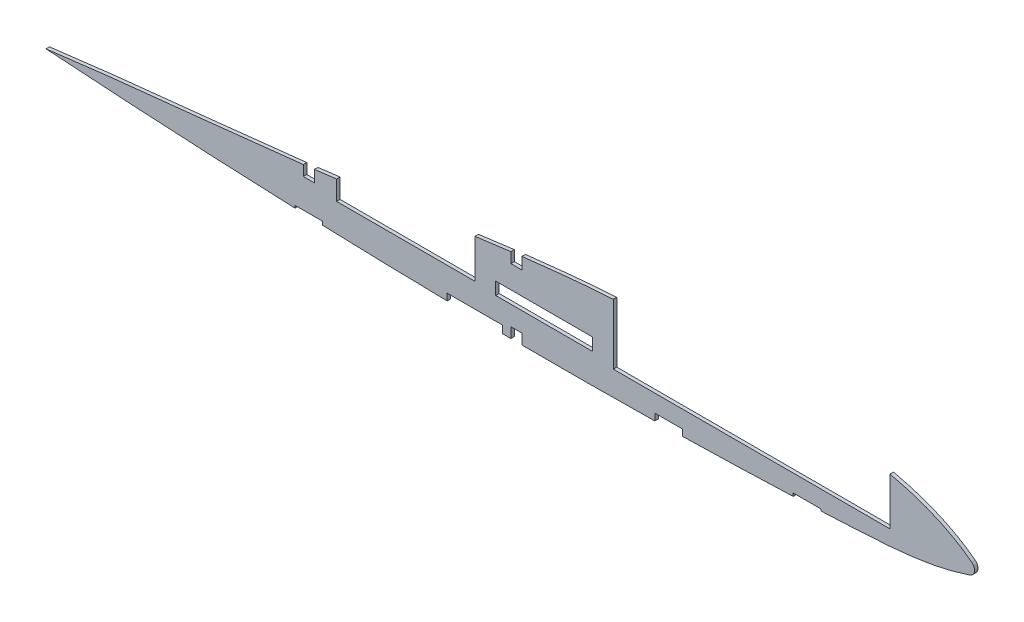
from build123d import *

# Parameters (mm, degrees)
BOSS_EXTRUDE1_DEPTH   = 3.175
FILLET1_R             = 6.35
CUT_EXTRUDE5_REACH    = 505.743
SKETCH5_W             = 88.9
SKETCH5_H             = 11.43
CUT_EXTRUDE3_DEPTH    = 5.08
CUT_EXTRUDE6_REACH    = 505.743
CUT_EXTRUDE4_DEPTH    = 5.08
CAVITY1_START         = -116.877115344
CAVITY1_OUTLINE_W     = 26.033160117
CAVITY1_OUTLINE_H     = 6
CAVITY1_DEPTH         = 10.16
CAVITY1_START_2       = 73.557724966
CAVITY1_2_OUTLINE_W   = 11.245727141
CAVITY1_2_OUTLINE_H   = 6
CAVITY1_2_OUTLINE_W_2 = 12.584380536
CAVITY1_2_DEPTH       = 10.16


# Read off the part's stored shape, not the designer's step: Cavity1
with BuildPart() as part:
    # Sketch1 → Boss-Extrude1 (new body)
    with BuildSketch(Plane.XY):
        with BuildLine():
            add(Edge.make_bspline(
                [(-353.097115344, 3.76640622), (-263.60988857, 15.489732087), (-103.405625954, 27.702523148), (139.625383809, 69.731889132), (320.600909148, 70.897971745), (447.029350736, 49.156772515), (484.461992977, 32.39779841), (505.225432444, 13.29140622)],
                knots=[0, 0, 0, 0, 0.308401543, 0.542913332, 0.850169973, 0.887176211, 1, 1, 1, 1], degree=3))
            add(Edge.make_bspline(
                [(-353.097115344, 3.76640622), (-171.204173065, -8.622681299), (70.681231732, -17.726989966), (367.634485174, -8.589262826), (467.934967897, -1.634661846), (505.225432444, 13.29140622)],
                knots=[0, 0, 0, 0, 0.625313044, 0.861778666, 1, 1, 1, 1], degree=3))
        make_face()
    extrude(amount=BOSS_EXTRUDE1_DEPTH)

    # Fillet1
    fillet1_edges = [part.edges().sort_by_distance(p)[0] for p in [
        (505.225432444, 13.29140622, 1.5875),
    ]]
    fillet(fillet1_edges, radius=FILLET1_R)

    # Sketch7 → Cut-Extrude5 (cut, up to next)
    with BuildSketch(Plane(origin=(0, 0, 0), x_dir=(-1, 0, 0), z_dir=(0, 0, -1)), mode=Mode.PRIVATE) as cut_extrude5_sk1:
        with BuildLine():
            Line((-358.102884656, -6.35), (-332.702884656, -6.35))
            Line((-332.702884656, -6.35), (-332.702884656, -9.096739879))
            add(Edge.make_bspline(
                [(-332.702884656, -9.096739879), (-341.216325131, -8.753253809), (-349.686543734, -8.388301604), (-358.102884656, -8.001631902)],
                knots=[0.79148957, 0.79148957, 0.79148957, 0.79148957, 0.821107867, 0.821107867, 0.821107867, 0.821107867], degree=3))
            Line((-358.102884656, -8.001631902), (-358.102884656, -6.35))
        make_face()
    cut_extrude5_tool1 = extrude(cut_extrude5_sk1.sketch, amount=-CUT_EXTRUDE5_REACH, mode=Mode.PRIVATE) & part.part
    # Sketch7 → Cut-Extrude5 (cut, up to next)
    with BuildSketch(Plane(origin=(0, 0, 0), x_dir=(-1, 0, 0), z_dir=(0, 0, -1)), mode=Mode.PRIVATE) as cut_extrude5_sk2:
        with BuildLine():
            Line((-231.102884656, -6.35), (-205.702884656, -6.35))
            Line((-205.702884656, -6.35), (-205.702884656, -12.629236372))
            add(Edge.make_bspline(
                [(-205.702884656, -12.629236372), (-214.16430095, -12.49359489), (-222.634256581, -12.338730353), (-231.102884656, -12.164410009)],
                knots=[0.646368105, 0.646368105, 0.646368105, 0.646368105, 0.675236637, 0.675236637, 0.675236637, 0.675236637], degree=3))
            Line((-231.102884656, -12.164410009), (-231.102884656, -6.35))
        make_face()
    cut_extrude5_tool2 = extrude(cut_extrude5_sk2.sketch, amount=-CUT_EXTRUDE5_REACH, mode=Mode.PRIVATE) & part.part
    # Sketch7 → Cut-Extrude5 (cut, up to next)
    with BuildSketch(Plane(origin=(0, 0, 0), x_dir=(-1, 0, 0), z_dir=(0, 0, -1)), mode=Mode.PRIVATE) as cut_extrude5_sk3:
        with BuildLine():
            Line((-65.93772502, -6.35), (-15.13772502, -6.35))
            Line((-15.13772502, -6.35), (-15.13772502, -12.521395898))
            add(Edge.make_bspline(
                [(-15.13772502, -12.521395898), (-32.040463908, -12.805124192), (-48.969973263, -13.018530998), (-65.93772502, -13.158984983)],
                knots=[0.427180219, 0.427180219, 0.427180219, 0.427180219, 0.48603051, 0.48603051, 0.48603051, 0.48603051], degree=3))
            Line((-65.93772502, -13.158984983), (-65.93772502, -6.35))
        make_face()
    cut_extrude5_tool3 = extrude(cut_extrude5_sk3.sketch, amount=-CUT_EXTRUDE5_REACH, mode=Mode.PRIVATE) & part.part
    # Sketch7 → Cut-Extrude5 (cut, up to next)
    with BuildSketch(Plane(origin=(0, 0, 0), x_dir=(-1, 0, 0), z_dir=(0, 0, -1)), mode=Mode.PRIVATE) as cut_extrude5_sk4:
        with BuildLine():
            Line((99.097115344, -6.35), (124.497115344, -6.35))
            Line((124.497115344, -6.35), (124.497115344, -8.618440951))
            add(Edge.make_bspline(
                [(124.497115344, -8.618440951), (116.029695194, -8.946223445), (107.563514441, -9.25806826), (99.097115344, -9.553641032)],
                knots=[0.264694306, 0.264694306, 0.264694306, 0.264694306, 0.294281016, 0.294281016, 0.294281016, 0.294281016], degree=3))
            Line((99.097115344, -9.553641032), (99.097115344, -6.35))
        make_face()
    cut_extrude5_tool4 = extrude(cut_extrude5_sk4.sketch, amount=-CUT_EXTRUDE5_REACH, mode=Mode.PRIVATE) & part.part
    add(cut_extrude5_tool1.solids().sort_by_distance((344.35466, -7.478114, 0))[0], mode=Mode.SUBTRACT)
    add(cut_extrude5_tool2.solids().sort_by_distance((218.240446, -9.379718, 0))[0], mode=Mode.SUBTRACT)
    add(cut_extrude5_tool3.solids().sort_by_distance((40.951434, -9.615723, 0))[0], mode=Mode.SUBTRACT)
    add(cut_extrude5_tool4.solids().sort_by_distance((-111.075712, -7.735326, 0))[0], mode=Mode.SUBTRACT)

    # Sketch5 → Cut-Extrude3 (cut)
    with BuildSketch(Plane.XY):
        with Locations((104.102884656, 19.812)):
            Rectangle(SKETCH5_W, SKETCH5_H)
    extrude(amount=CUT_EXTRUDE3_DEPTH, mode=Mode.SUBTRACT)

    # Sketch8 → Cut-Extrude6 (cut, up to next)
    with BuildSketch(Plane(origin=(0, 0, 0), x_dir=(-1, 0, 0), z_dir=(0, 0, -1)), mode=Mode.PRIVATE) as cut_extrude6_sk1:
        with BuildLine():
            Line((-421.602884656, 53.128136288), (-421.602884656, 9.525))
            Line((-421.602884656, 9.525), (-167.602884656, 9.525))
            Line((-167.602884656, 9.525), (-167.602884656, 65.051503813))
            add(Edge.make_bspline(
                [(-167.602884656, 65.051503813), (-244.722722107, 70.03272949), (-333.181087562, 68.488590043), (-412.953469478, 55.01226242), (-421.602884656, 53.128136288)],
                knots=[0.594152543, 0.594152543, 0.594152543, 0.594152543, 0.850169973, 0.88199459, 0.88199459, 0.88199459, 0.88199459], degree=3))
        make_face()
    cut_extrude6_tool1 = extrude(cut_extrude6_sk1.sketch, amount=-CUT_EXTRUDE6_REACH, mode=Mode.PRIVATE) & part.part
    add(cut_extrude6_tool1.solids().sort_by_distance((290.394323, 37.11831, 0))[0], mode=Mode.SUBTRACT)

    # Sketch6 → Cut-Extrude4 (cut)
    with BuildSketch(Plane.XY):
        with BuildLine():
            Line((40.602884656, 51.591569772), (40.602884656, 15.875))
            Line((40.602884656, 15.875), (-86.397115344, 15.875))
            Line((-86.397115344, 15.875), (-86.397115344, 33.671872302))
            add(Edge.make_bspline(
                [(-86.397115344, 33.671872302), (-85.336997309, 33.80875443), (-42.923565209, 39.312219047), (-0.873657075, 45.877823306), (40.602884656, 51.591569772)],
                knots=[0.304745552, 0.304745552, 0.304745552, 0.304745552, 0.308401543, 0.451045815, 0.451045815, 0.451045815, 0.451045815], degree=3))
        make_face()
    extrude(amount=CUT_EXTRUDE4_DEPTH, mode=Mode.SUBTRACT)

    # Cavity1 outline → Cavity1 (cut)
    with BuildSketch(Plane.YZ.offset(CAVITY1_START)):
        with Locations((33.399039406, 2)):
            Rectangle(CAVITY1_OUTLINE_W, CAVITY1_OUTLINE_H)
    extrude(amount=CAVITY1_DEPTH, mode=Mode.SUBTRACT)

    # Cavity1 2 outline → Cavity1 2 (cut)
    with BuildSketch(Plane.YZ.offset(CAVITY1_START_2)):
        with Locations((-9.37713643, 2)):
            Rectangle(CAVITY1_2_OUTLINE_W, CAVITY1_2_OUTLINE_H)
        with Locations((52.707809732, 2)):
            Rectangle(CAVITY1_2_OUTLINE_W_2, CAVITY1_2_OUTLINE_H)
    extrude(amount=CAVITY1_2_DEPTH, mode=Mode.SUBTRACT)


solid = part.part
